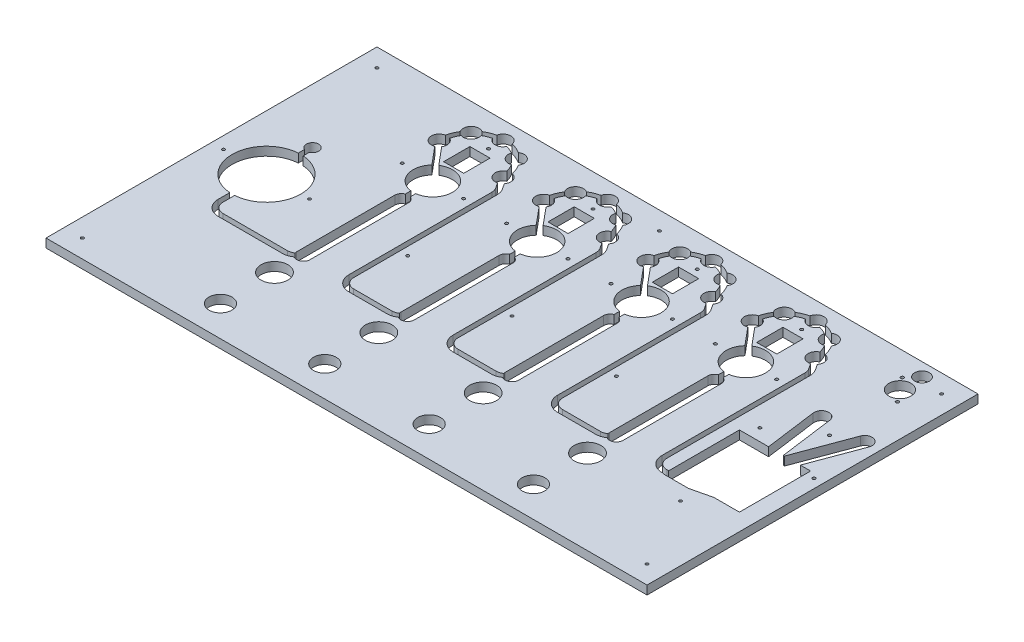
from build123d import *

# Parameters (mm, degrees)
SKETCH1_W                      = 660.4
SKETCH1_H                      = 381
SHEET_DEPTH                    = 8.9916
SKETCH2_4_W                    = 20.828
SKETCH2_4_H                    = 27.178
SKETCH2_4_R                    = 20.32
SKETCH2_4_R_2                  = 11.811
SKETCH2_4_R_3                  = 13.843
SKETCH2_4_R_4                  = 8.128
CHANNEL_CONTROLS_ROUTING_DEPTH = 382.317635142
LPATTERN1_COUNT                = 4
LPATTERN1_PITCH                = 107.95
SKETCH5_R                      = 35.56
TEMPO_ROUTING_DEPTH            = 382.317635142
SKETCH6_R                      = 7.62
SKETCH6_R_2                    = 11.43
SKETCH6_R_3                    = 1.651
MIC_ROUTING_BOTTOM_DEPTH       = 382.317635142
BEET_TV_ROUTING_DEPTH          = 382.317635142
WIRING_PATH_1_DEPTH            = 382.317635142
LPATTERN2_COUNT                = 4
LPATTERN2_PITCH                = 107.95
WIRING_PATH_2_DEPTH            = 382.317635142
WIRING_PATH_2_DEPTH_BACK       = 382.317635142
SKETCH16_R                     = 6.35
WIRING_PATH_INPUT_DEPTH        = 382.317635142
SKETCH18_R                     = 1.524
INSIDE_SCREW_HOLES_DEPTH       = 382.317635142
SKETCH17_W                     = 660.4
SKETCH17_H                     = 381
SKETCH17_W_2                   = 621.792
SKETCH17_H_2                   = 342.392
CUT_IN_EDGES_DEPTH             = 382.317635142


with BuildPart() as part:
    # Sketch1 → Sheet (new body)
    with BuildSketch(Plane(origin=(0, 0, 0), x_dir=(1, 0, 0), z_dir=(0, 1, 0))):
        Rectangle(SKETCH1_W, SKETCH1_H)
    extrude(amount=SHEET_DEPTH)

    # Sketch2<4> → Channel Controls - Routing (cut, through all)
    with BuildSketch(Plane(origin=(0, 8.9916, 0), x_dir=(1, 0, 0), z_dir=(0, 1, 0))):
        with BuildLine():
            Line((-154.94, -53.975), (-154.94, 47.625))
            ThreePointArc((-154.94, 47.625), (-161.925, 54.61), (-168.91, 47.625))
            Line((-168.91, 47.625), (-168.91, -53.975))
            ThreePointArc((-168.91, -53.975), (-161.925, -60.96), (-154.94, -53.975))
        make_face()
        with Locations((-163.195, 116.459)):
            Rectangle(SKETCH2_4_W, SKETCH2_4_H)
        with Locations((-161.925, 80.01)):
            Circle(SKETCH2_4_R)
        with Locations((-161.925, -139.7)):
            Circle(SKETCH2_4_R_2)
        with Locations((-161.925, -83.82)):
            Circle(SKETCH2_4_R_3)
        with Locations((-194.945, 119.634)):
            Circle(SKETCH2_4_R_4)
        with Locations((-185.273665915, 142.982665915)):
            Circle(SKETCH2_4_R_4)
        with Locations((-161.925, 152.654)):
            Circle(SKETCH2_4_R_4)
        with Locations((-138.576334085, 142.982665915)):
            Circle(SKETCH2_4_R_4)
        with Locations((-128.905, 119.634)):
            Circle(SKETCH2_4_R_4)
    channel_controls_routing = extrude(amount=-CHANNEL_CONTROLS_ROUTING_DEPTH, mode=Mode.SUBTRACT)

    # LPattern1: Channel Controls - Routing ×4
    with Locations(*[(i * LPATTERN1_PITCH, 0, 0) for i in range(1, LPATTERN1_COUNT)]):
        add(channel_controls_routing, mode=Mode.SUBTRACT)

    # Sketch5 → Tempo - Routing (cut, through all)
    with BuildSketch(Plane(origin=(0, 8.9916, 0), x_dir=(1, 0, 0), z_dir=(0, 1, 0))):
        with Locations((-254, 0)):
            Circle(SKETCH5_R)
    extrude(amount=-TEMPO_ROUTING_DEPTH, mode=Mode.SUBTRACT)

    # Sketch6 → Mic - Routing/Bottom (cut, through all)
    with BuildSketch(Plane(origin=(0, 8.9916, 0), x_dir=(1, 0, 0), z_dir=(0, 1, 0))):
        with Locations((266.7, 157.48)):
            Circle(SKETCH6_R)
        with Locations((266.7, 134.62)):
            Circle(SKETCH6_R_2)
        with Locations((257.048, 146.812)):
            Circle(SKETCH6_R_3)
        with Locations((276.352, 122.428)):
            Circle(SKETCH6_R_3)
    extrude(amount=-MIC_ROUTING_BOTTOM_DEPTH, mode=Mode.SUBTRACT)

    # Sketch11 → Beet TV - Routing (cut, through all)
    with BuildSketch(Plane(origin=(0, 8.9916, 0), x_dir=(1, 0, 0), z_dir=(0, 1, 0))):
        with BuildLine():
            ThreePointArc((302.034783396, 67.358425359), (297.556602625, 77.160195454), (287.75483253, 72.682014683))
            Line((287.75483253, 72.682014683), (266.460475237, 15.562211221))
            Line((266.460475237, 15.562211221), (265.237040158, 15.562211221))
            Line((265.237040158, 15.562211221), (257.784848649, 70.943067496))
            ThreePointArc((257.784848649, 70.943067496), (249.21670577, 77.47879451), (242.680978756, 68.91065163))
            Line((242.680978756, 68.91065163), (249.85968312, 15.562211221))
            Line((249.85968312, 15.562211221), (219.712299534, 15.562211221))
            Line((219.712299534, 15.562211221), (219.712299534, -63.177788779))
            Line((219.712299534, -63.177788779), (245.802639966, -63.177788779))
            Line((245.802639966, -63.177788779), (267.084388511, -58.097788779))
            Line((267.084388511, -58.097788779), (293.372299534, -58.097788779))
            Line((293.372299534, -58.097788779), (293.372299534, 15.562211221))
            Line((293.372299534, 15.562211221), (282.725069015, 15.562211221))
            Line((282.725069015, 15.562211221), (302.034783396, 67.358425359))
        make_face()
    extrude(amount=-BEET_TV_ROUTING_DEPTH, mode=Mode.SUBTRACT)

    # Sketch13 → Wiring Path 1 (cut, symmetric)
    with BuildSketch(Plane(origin=(0, 8.9916, 0), x_dir=(1, 0, 0), z_dir=(0, 1, 0))):
        with BuildLine():
            Line((-85.92392107, -57.642214302), (-106.107964058, -57.642214302))
            ThreePointArc((-106.107964058, -57.642214302), (-113.292168954, -54.666419198), (-116.267964058, -47.482214302))
            Line((-116.267964058, -47.482214302), (-116.267964058, 100.516665083))
            ThreePointArc((-116.267964058, 100.516665083), (-116.911231157, 104.897645411), (-118.786728969, 108.908791025))
            Line((-118.786728969, 108.908791025), (-126.375798908, 120.412710707))
            ThreePointArc((-126.375798908, 120.412710707), (-162.779826831, 155.079647482), (-197.475553679, 118.703057579))
            Line((-197.475553679, 118.703057579), (-164.465, 79.090393165))
            Line((-164.465, 79.090393165), (-164.465, -47.482214302))
            ThreePointArc((-164.465, -47.482214302), (-167.440795103, -54.666419198), (-174.625, -57.642214302))
            Line((-174.625, -57.642214302), (-193.87392107, -57.642214302))
            Line((-193.87392107, -57.642214302), (-193.87392107, -62.722214302))
            Line((-193.87392107, -62.722214302), (-174.625, -62.722214302))
            ThreePointArc((-174.625, -62.722214302), (-163.848692655, -58.258521647), (-159.385, -47.482214302))
            Line((-159.385, -47.482214302), (-159.385, 80.929606835))
            Line((-159.385, 80.929606835), (-192.388618193, 120.533948667))
            ThreePointArc((-192.388618193, 120.533948667), (-161.09893612, 149.998727591), (-131.451722474, 118.881849145))
            Line((-131.451722474, 118.881849145), (-123.027140665, 106.111415711))
            ThreePointArc((-123.027140665, 106.111415711), (-121.77680879, 103.437318635), (-121.347964058, 100.516665083))
            Line((-121.347964058, 100.516665083), (-121.347964058, -47.482214302))
            ThreePointArc((-121.347964058, -47.482214302), (-116.884271403, -58.258521647), (-106.107964058, -62.722214302))
            Line((-106.107964058, -62.722214302), (-85.92392107, -62.722214302))
            Line((-85.92392107, -62.722214302), (-85.92392107, -57.642214302))
        make_face()
    wiring_path_1 = extrude(amount=WIRING_PATH_1_DEPTH, both=True, mode=Mode.SUBTRACT)

    # LPattern2: Wiring Path 1 ×4
    with Locations(*[(i * LPATTERN2_PITCH, 0, 0) for i in range(1, LPATTERN2_COUNT)]):
        add(wiring_path_1, mode=Mode.SUBTRACT)

    # Sketch15 → Wiring Path 2 (cut, two sides: drawn at the far end of the back side and taken through both)
    with BuildSketch(Plane(origin=(0, 8.9916, 0), x_dir=(1, 0, 0), z_dir=(0, 1, 0)).offset(-WIRING_PATH_2_DEPTH_BACK)):
        with BuildLine():
            Line((-256.54, 47.675648725), (-256.54, -47.482214302))
            ThreePointArc((-256.54, -47.482214302), (-252.076307345, -58.258521647), (-241.3, -62.722214302))
            Line((-241.3, -62.722214302), (-193.87392107, -62.722214302))
            Line((-193.87392107, -62.722214302), (-193.87392107, -57.642214302))
            Line((-193.87392107, -57.642214302), (-241.3, -57.642214302))
            ThreePointArc((-241.3, -57.642214302), (-248.484204897, -54.666419198), (-251.46, -47.482214302))
            Line((-251.46, -47.482214302), (-251.46, 47.675648725))
            Line((-251.46, 47.675648725), (-256.54, 47.675648725))
        make_face()
    extrude(amount=WIRING_PATH_2_DEPTH + WIRING_PATH_2_DEPTH_BACK, mode=Mode.SUBTRACT)

    # Sketch16 → Wiring Path Input (cut, through all)
    with BuildSketch(Plane(origin=(0, 8.9916, 0), x_dir=(1, 0, 0), z_dir=(0, 1, 0))):
        with Locations((-254, 47.675648725)):
            Circle(SKETCH16_R)
    extrude(amount=-WIRING_PATH_INPUT_DEPTH, mode=Mode.SUBTRACT)

    # Sketch18 → Inside Screw Holes (cut, through all)
    with BuildSketch(Plane(origin=(0, 8.9916, 0), x_dir=(1, 0, 0), z_dir=(0, 1, 0))):
        with Locations((-193.675, 80.158564581)):
            Circle(SKETCH18_R)
        with Locations((-161.925, 137.7044104)):
            Circle(SKETCH18_R)
        with Locations((-298.45, 0)):
            Circle(SKETCH18_R)
        with Locations((-209.55, 0)):
            Circle(SKETCH18_R)
        with Locations((-107.95, 0)):
            Circle(SKETCH18_R)
        with Locations((-292.1, 152.4)):
            Circle(SKETCH18_R)
        with Locations((0, 152.4)):
            Circle(SKETCH18_R)
        with Locations((-130.175, 80.158564581)):
            Circle(SKETCH18_R)
        with Locations((301.701065048, 10.72901122)):
            Circle(SKETCH18_R)
        with Locations((228.429380072, 27.954149694)):
            Circle(SKETCH18_R)
        with Locations((271.116831878, 57.283623384)):
            Circle(SKETCH18_R)
        with Locations((292.1, 152.4)):
            Circle(SKETCH18_R)
        Circle(SKETCH18_R)
        with Locations((107.95, 0)):
            Circle(SKETCH18_R)
        with Locations((252.912933296, -78.628784773)):
            Circle(SKETCH18_R)
        with Locations((292.1, -152.4)):
            Circle(SKETCH18_R)
        with Locations((-292.1, -152.4)):
            Circle(SKETCH18_R)
        with Locations((-53.975, 137.7044104)):
            Circle(SKETCH18_R)
        with Locations((-85.725, 80.158564581)):
            Circle(SKETCH18_R)
        with Locations((-22.225, 80.158564581)):
            Circle(SKETCH18_R)
        with Locations((53.975, 137.7044104)):
            Circle(SKETCH18_R)
        with Locations((22.225, 80.158564581)):
            Circle(SKETCH18_R)
        with Locations((85.725, 80.158564581)):
            Circle(SKETCH18_R)
        with Locations((161.925, 137.7044104)):
            Circle(SKETCH18_R)
        with Locations((130.175, 80.158564581)):
            Circle(SKETCH18_R)
        with Locations((193.675, 80.158564581)):
            Circle(SKETCH18_R)
    extrude(amount=-INSIDE_SCREW_HOLES_DEPTH, mode=Mode.SUBTRACT)

    # Sketch17 → Cut In Edges (cut, through all)
    with BuildSketch(Plane(origin=(0, 8.9916, 0), x_dir=(1, 0, 0), z_dir=(0, 1, 0))):
        Rectangle(SKETCH17_W, SKETCH17_H)
        Rectangle(SKETCH17_W_2, SKETCH17_H_2, mode=Mode.SUBTRACT)
    extrude(amount=-CUT_IN_EDGES_DEPTH, mode=Mode.SUBTRACT)


solid = part.part
